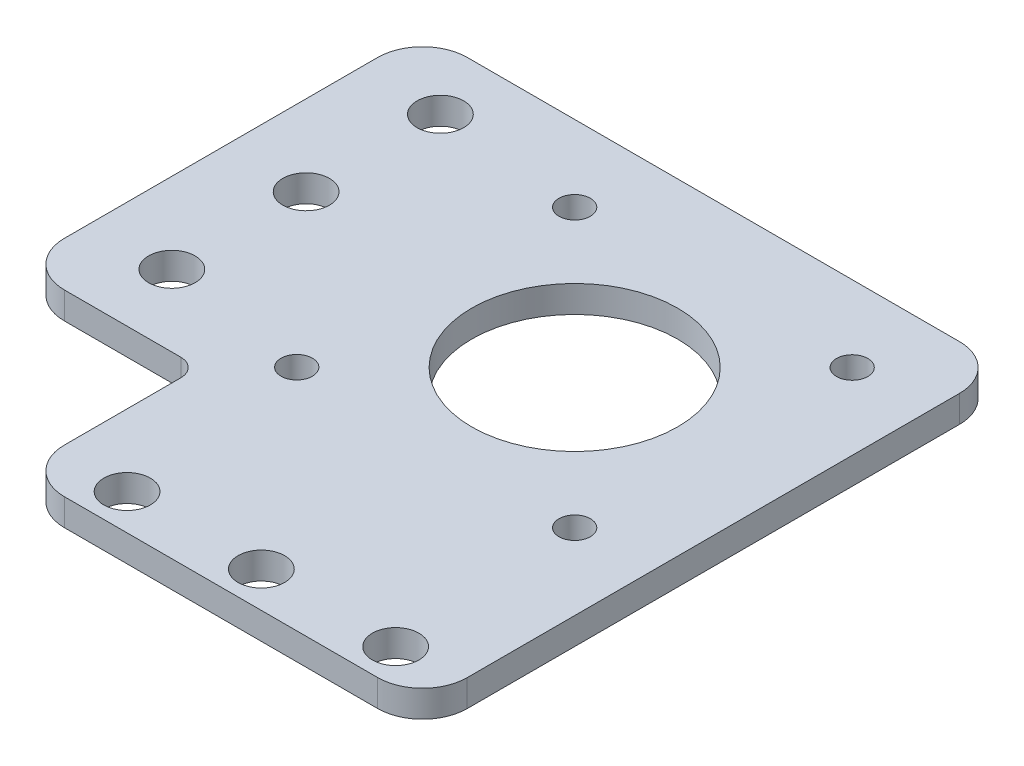
from build123d import *

# Parameters (mm, degrees)
SKETCH2_R          = 2.6
SKETCH2_R_2        = 1.75
SKETCH2_R_3        = 11.5
BASE_FLANGE1_DEPTH = 3
FILLET1_R          = 5
FILLET2_R          = 2


# Sheet-metal steps are written as plain solids
with BuildPart() as part:
    # Sketch2 → Base-Flange1 (new body)
    with BuildSketch(Plane(origin=(0, 0, 0), x_dir=(1, 0, 0), z_dir=(0, 1, 0))):
        Polygon((0, 70), (65, 70), (65, 5), (20, 5), (20, 25), (0, 25), align=None)
        with Locations(Location((28, 9, 0), (0, 0, 270))):
            Circle(SKETCH2_R, mode=Mode.SUBTRACT)
        with Locations(Location((43, 9, 0), (0, 0, 270))):
            Circle(SKETCH2_R, mode=Mode.SUBTRACT)
        with Locations(Location((58, 9, 0), (0, 0, 270))):
            Circle(SKETCH2_R, mode=Mode.SUBTRACT)
        with Locations(Location((9, 33, 0), (0, 0, 270))):
            Circle(SKETCH2_R, mode=Mode.SUBTRACT)
        with Locations(Location((9, 48, 0), (0, 0, 270))):
            Circle(SKETCH2_R, mode=Mode.SUBTRACT)
        with Locations(Location((9, 63, 0), (0, 0, 270))):
            Circle(SKETCH2_R, mode=Mode.SUBTRACT)
        with Locations(Location((25.5, 61.5, 0), (0, 0, 270))):
            Circle(SKETCH2_R_2, mode=Mode.SUBTRACT)
        with Locations(Location((56.5, 61.5, 0), (0, 0, 270))):
            Circle(SKETCH2_R_2, mode=Mode.SUBTRACT)
        with Locations(Location((56.5, 30.5, 0), (0, 0, 270))):
            Circle(SKETCH2_R_2, mode=Mode.SUBTRACT)
        with Locations(Location((25.44917982, 30.502293897, 0), (0, 0, 270))):
            Circle(SKETCH2_R_2, mode=Mode.SUBTRACT)
        with Locations(Location((41, 46, 0), (0, 0, 270))):
            Circle(SKETCH2_R_3, mode=Mode.SUBTRACT)
    extrude(amount=-BASE_FLANGE1_DEPTH)

    # Fillet1
    fillet1_edges = [part.edges().sort_by_distance(p)[0] for p in [
        (0, -1.5, -25),
        (0, -1.5, -70),
        (65, -1.5, -70),
        (65, -1.5, -5),
        (20, -1.5, -5),
    ]]
    fillet(fillet1_edges, radius=FILLET1_R)

    # Fillet2
    fillet2_edges = [part.edges().sort_by_distance(p)[0] for p in [
        (20, -1.5, -25),
    ]]
    fillet(fillet2_edges, radius=FILLET2_R)


solid = part.part
